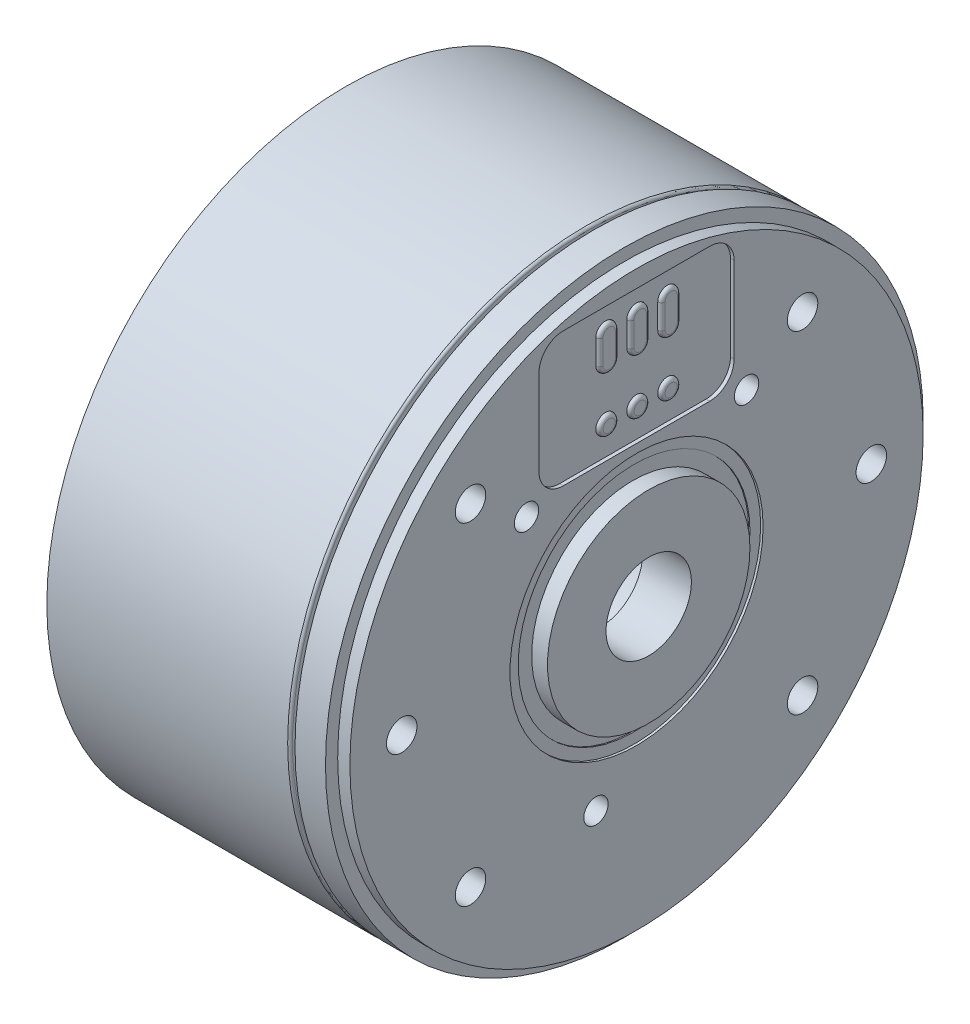
from build123d import *

# Parameters (mm, degrees)
SKETCH_2_R           = 24.5
EXTRUDE_1_DEPTH      = 24
SKETCH_2_17_R        = 24.5
CUT_EXTRUDE_18_DEPTH = 21.5
SKETCH_2_18_R        = 24.5
EXTRUDE_7_DEPTH      = 21.1
SKETCH_2_5_R         = 23.5
EXTRUDE_2_DEPTH      = 25
SKETCH_2_14_R        = 1.5
CUT_EXTRUDE_12_DEPTH = 4
CHAMFER_1_SIZE       = 2
CHAMFER_1_SIZE2      = 1.154700538
SKETCH_2_15_R        = 6.3
SKETCH_2_15_R_2      = 3.5
CUT_EXTRUDE_13_DEPTH = 22
SKETCH_2_16_R        = 3.5
CUT_EXTRUDE_16_DEPTH = 27
SKETCH_3_R           = 8.3
SKETCH_3_R_2         = 3.5
EXTRUDE_6_DEPTH      = 1
SKETCH_3_7_R         = 1.25
SKETCH_3_7_R_2       = 1
CUT_EXTRUDE_17_DEPTH = 4
CUT_EXTRUDE_START    = -0.3
SKETCH_3_8_R         = 9.5
SKETCH_3_8_R_2       = 8.3
CUT_EXTRUDE_19_DEPTH = 0.3
CUT_EXTRUDE_START_2  = -0.2
SKETCH_3_9_R         = 10.377256728
SKETCH_3_9_R_2       = 9.5
CUT_EXTRUDE_20_DEPTH = 0.2
CUT_EXTRUDE_21_DEPTH = 0.3
EXTRUDE_8_DEPTH      = 0.3
EXTRUDE_8_2_DEPTH    = 0.3
EXTRUDE_8_3_DEPTH    = 0.3
FILLET_1_R           = 0.3
FILLET_2_R           = 0.3
FILLET_3_R           = 0.3
SKETCH_3_13_R        = 0.8
EXTRUDE_9_DEPTH      = 0.3
EXTRUDE_9_2_DEPTH    = 0.3
EXTRUDE_9_3_DEPTH    = 0.3
FILLET_4_R           = 0.3
FILLET_5_R           = 0.3
FILLET_6_R           = 0.3
FILLET_7_R           = 0.2


# Some blends are built 0.0001 mm under size
with BuildPart() as part:
    # 草图2 → 凸台-拉伸1 (new body)
    with BuildSketch(Plane(origin=(0, 0, 0), x_dir=(0, 0, -1), z_dir=(1, 0, 0))):
        Circle(SKETCH_2_R)
    extrude(amount=EXTRUDE_1_DEPTH)

    # 草图2<17> → 切除-拉伸18 (cut)
    with BuildSketch(Plane(origin=(0, 0, 0), x_dir=(0, 0, -1), z_dir=(1, 0, 0))):
        Circle(SKETCH_2_17_R)
    extrude(amount=CUT_EXTRUDE_18_DEPTH, mode=Mode.SUBTRACT)



with BuildPart() as body_2:
    # 草图2<18> → 凸台-拉伸7 (new body)
    with BuildSketch(Plane(origin=(0, 0, 0), x_dir=(0, 0, -1), z_dir=(1, 0, 0))):
        Circle(SKETCH_2_18_R)
    extrude(amount=EXTRUDE_7_DEPTH)


with BuildPart() as part_1:
    add(part.part)

    add(body_2.part)  # 凸台-拉伸2 merges body 2
    # 草图2<5> → 凸台-拉伸2 (add)
    with BuildSketch(Plane(origin=(0, 0, 0), x_dir=(0, 0, -1), z_dir=(1, 0, 0))):
        Circle(SKETCH_2_5_R)
    extrude(amount=EXTRUDE_2_DEPTH)

    # 草图2<14> → 切除-拉伸12 (cut)
    with BuildSketch(Plane(origin=(0, 0, 0), x_dir=(0, 0, -1), z_dir=(1, 0, 0))):
        with Locations((0, 9.5)):
            Circle(SKETCH_2_14_R)
        with Locations((9.5, 0)):
            Circle(SKETCH_2_14_R)
        with Locations((0, -9.5)):
            Circle(SKETCH_2_14_R)
        with Locations((-9.5, 0)):
            Circle(SKETCH_2_14_R)
        with Locations((8.838834765, 8.838834765)):
            Circle(SKETCH_2_14_R)
        with Locations((8.838834765, -8.838834765)):
            Circle(SKETCH_2_14_R)
        with Locations((-8.838834765, -8.838834765)):
            Circle(SKETCH_2_14_R)
        with Locations((-8.838834765, 8.838834765)):
            Circle(SKETCH_2_14_R)
    extrude(amount=CUT_EXTRUDE_12_DEPTH, mode=Mode.SUBTRACT)

    # 倒角1
    chamfer_1_edges = [part_1.edges().sort_by_distance(p)[0] for p in [
        (0, 0, 24.5),
    ]]
    chamfer_1_side = [part_1.faces().sort_by_distance(p)[0] for p in [
        (0, 0, 0),
    ]]
    chamfer(chamfer_1_edges, length=CHAMFER_1_SIZE, length2=CHAMFER_1_SIZE2, reference=chamfer_1_side[0])

    # 草图2<15> → 切除-拉伸13 (cut)
    with BuildSketch(Plane(origin=(0, 0, 0), x_dir=(0, 0, -1), z_dir=(1, 0, 0))):
        Circle(SKETCH_2_15_R)
        Circle(SKETCH_2_15_R_2, mode=Mode.SUBTRACT)
    extrude(amount=CUT_EXTRUDE_13_DEPTH, mode=Mode.SUBTRACT)

    # 草图2<16> → 切除-拉伸16 (cut)
    with BuildSketch(Plane(origin=(0, 0, 0), x_dir=(0, 0, -1), z_dir=(1, 0, 0))):
        Circle(SKETCH_2_16_R)
    extrude(amount=CUT_EXTRUDE_16_DEPTH, mode=Mode.SUBTRACT)

    # 草图3 → 凸台-拉伸6 (add)
    with BuildSketch(Plane(origin=(25, 0, 0), x_dir=(0, 0, -1), z_dir=(1, 0, 0))):
        Circle(SKETCH_3_R)
        Circle(SKETCH_3_R_2, mode=Mode.SUBTRACT)
    extrude(amount=EXTRUDE_6_DEPTH)

    # 草图3<7> → 切除-拉伸17 (cut)
    with BuildSketch(Plane(origin=(25, 0, 0), x_dir=(0, 0, -1), z_dir=(1, 0, 0))):
        with Locations((13.611805538, 13.611805538)):
            Circle(SKETCH_3_7_R)
        with Locations((13.611805538, -13.611805538)):
            Circle(SKETCH_3_7_R)
        with Locations((-3.326426064, -13.341566236)):
            Circle(SKETCH_3_7_R_2)
        with Locations((-13.611805538, -13.611805538)):
            Circle(SKETCH_3_7_R)
        with Locations((-13.611805538, 13.611805538)):
            Circle(SKETCH_3_7_R)
        with Locations((-19.25, 0)):
            Circle(SKETCH_3_7_R)
        with Locations((19.25, 0)):
            Circle(SKETCH_3_7_R)
        with Locations((9.020811649, 10.377256728)):
            Circle(SKETCH_3_7_R_2)
        with Locations((-9.020811649, 10.377256728)):
            Circle(SKETCH_3_7_R_2)
    extrude(amount=-CUT_EXTRUDE_17_DEPTH, mode=Mode.SUBTRACT)

    # 草图3<8> → 切除-拉伸19 (cut)
    with BuildSketch(Plane(origin=(25, 0, 0), x_dir=(0, 0, -1), z_dir=(1, 0, 0)).offset(CUT_EXTRUDE_START)):
        Circle(SKETCH_3_8_R)
        Circle(SKETCH_3_8_R_2, mode=Mode.SUBTRACT)
    extrude(amount=CUT_EXTRUDE_19_DEPTH, mode=Mode.SUBTRACT)

    # 草图3<9> → 切除-拉伸20 (cut)
    with BuildSketch(Plane(origin=(25, 0, 0), x_dir=(0, 0, -1), z_dir=(1, 0, 0)).offset(CUT_EXTRUDE_START_2)):
        Circle(SKETCH_3_9_R)
        Circle(SKETCH_3_9_R_2, mode=Mode.SUBTRACT)
    extrude(amount=CUT_EXTRUDE_20_DEPTH, mode=Mode.SUBTRACT)

    # 草图3<10> → 切除-拉伸21 (cut)
    with BuildSketch(Plane(origin=(25, 0, 0), x_dir=(0, 0, -1), z_dir=(1, 0, 0))):
        with BuildLine():
            Line((-6, 11.077256728), (6, 11.077256728))
            ThreePointArc((6, 11.077256728), (7.414213562, 11.663043166), (8, 13.077256728))
            Line((8, 13.077256728), (8, 20.077256728))
            ThreePointArc((8, 20.077256728), (7.414213562, 21.49147029), (6, 22.077256728))
            Line((6, 22.077256728), (-6, 22.077256728))
            ThreePointArc((-6, 22.077256728), (-7.414213562, 21.49147029), (-8, 20.077256728))
            Line((-8, 20.077256728), (-8, 13.077256728))
            ThreePointArc((-8, 13.077256728), (-7.414213562, 11.663043166), (-6, 11.077256728))
        make_face()
    extrude(amount=-CUT_EXTRUDE_21_DEPTH, mode=Mode.SUBTRACT)

    # 圆角7
    fillet_7_edges = [part_1.edges().sort_by_distance(p)[0] for p in [
        (21.1, 0, 24.5),
    ]]
    fillet(fillet_7_edges, radius=FILLET_7_R)


with BuildPart() as body_2_2:
    # 草图3<12> → 凸台-拉伸8 (new body)
    with BuildSketch(Plane(origin=(25, 0, 0), x_dir=(0, 0, -1), z_dir=(1, 0, 0))):
        with BuildLine():
            Line((-3.34, 20.25), (-3.34, 18.25))
            ThreePointArc((-3.34, 18.25), (-2.54, 17.45), (-1.74, 18.25))
            Line((-1.74, 18.25), (-1.74, 20.25))
            ThreePointArc((-1.74, 20.25), (-2.54, 21.05), (-3.34, 20.25))
        make_face()
    extrude(amount=EXTRUDE_8_DEPTH)

    # 圆角1
    fillet_1_edges = [body_2_2.edges().sort_by_distance(p)[0] for p in [
        (25.3, 21.05, 2.54),
        (25.3, 19.25, 3.34),
        (25.3, 17.45, 2.54),
        (25.3, 19.25, 1.74),
    ]]
    fillet(fillet_1_edges, radius=FILLET_1_R - 0.0001)  # a hair under: the kernel refuses the full size


with BuildPart() as body_3:
    # 草图3<12> → Extrude 8 2 (new body)
    with BuildSketch(Plane(origin=(25, 0, 0), x_dir=(0, 0, -1), z_dir=(1, 0, 0))):
        with BuildLine():
            Line((1.74, 20.25), (1.74, 18.25))
            ThreePointArc((1.74, 18.25), (2.54, 17.45), (3.34, 18.25))
            Line((3.34, 18.25), (3.34, 20.25))
            ThreePointArc((3.34, 20.25), (2.54, 21.05), (1.74, 20.25))
        make_face()
    extrude(amount=EXTRUDE_8_2_DEPTH)

    # 圆角3
    fillet_3_edges = [body_3.edges().sort_by_distance(p)[0] for p in [
        (25.3, 21.05, -2.54),
        (25.3, 19.25, -1.74),
        (25.3, 17.45, -2.54),
        (25.3, 19.25, -3.34),
    ]]
    fillet(fillet_3_edges, radius=FILLET_3_R - 0.0001)  # a hair under: the kernel refuses the full size


with BuildPart() as body_4:
    # 草图3<12> → Extrude 8 3 (new body)
    with BuildSketch(Plane(origin=(25, 0, 0), x_dir=(0, 0, -1), z_dir=(1, 0, 0))):
        with BuildLine():
            Line((0.8, 20.25), (0.8, 18.25))
            ThreePointArc((0.8, 18.25), (0, 17.45), (-0.8, 18.25))
            Line((-0.8, 18.25), (-0.8, 20.25))
            ThreePointArc((-0.8, 20.25), (0, 21.05), (0.8, 20.25))
        make_face()
    extrude(amount=EXTRUDE_8_3_DEPTH)

    # 圆角2
    fillet_2_edges = [body_4.edges().sort_by_distance(p)[0] for p in [
        (25.3, 21.05, 0),
        (25.3, 19.25, 0.8),
        (25.3, 17.45, 0),
        (25.3, 19.25, -0.8),
    ]]
    fillet(fillet_2_edges, radius=FILLET_2_R - 0.0001)  # a hair under: the kernel refuses the full size


with BuildPart() as body_5:
    # 草图3<13> → 凸台-拉伸9 (new body)
    with BuildSketch(Plane(origin=(25, 0, 0), x_dir=(0, 0, -1), z_dir=(1, 0, 0))):
        with Locations((2.54, 13.75)):
            Circle(SKETCH_3_13_R)
    extrude(amount=EXTRUDE_9_DEPTH)

    # 圆角6
    # the kernel refuses this fillet: 0.3 mm, written as the material it takes off along each edge
    with BuildSketch(Plane(origin=(25.3, 13.75, -2.54), x_dir=(0, 0, -1), z_dir=(0, -1, 0))) as fillet_6_piece_1:
        with BuildLine():
            CenterArc((0.8 - FILLET_6_R, -FILLET_6_R), FILLET_6_R, 0, 90)
            Line((0.8 - FILLET_6_R, 0), (0.8, 0))
            Line((0.8, 0), (0.8, -FILLET_6_R))
        make_face()
    revolve(axis=Axis((25.3, 13.75, -2.54), (1, 0, 0)), mode=Mode.SUBTRACT)


with BuildPart() as body_6:
    # 草图3<13> → Extrude 9 2 (new body)
    with BuildSketch(Plane(origin=(25, 0, 0), x_dir=(0, 0, -1), z_dir=(1, 0, 0))):
        with Locations((-2.54, 13.75)):
            Circle(SKETCH_3_13_R)
    extrude(amount=EXTRUDE_9_2_DEPTH)

    # 圆角4
    # the kernel refuses this fillet: 0.3 mm, written as the material it takes off along each edge
    with BuildSketch(Plane(origin=(25.3, 13.75, 2.54), x_dir=(0, 0, -1), z_dir=(0, -1, 0))) as fillet_4_piece_1:
        with BuildLine():
            CenterArc((0.8 - FILLET_4_R, -FILLET_4_R), FILLET_4_R, 0, 90)
            Line((0.8 - FILLET_4_R, 0), (0.8, 0))
            Line((0.8, 0), (0.8, -FILLET_4_R))
        make_face()
    revolve(axis=Axis((25.3, 13.75, 2.54), (1, 0, 0)), mode=Mode.SUBTRACT)


with BuildPart() as body_7:
    # 草图3<13> → Extrude 9 3 (new body)
    with BuildSketch(Plane(origin=(25, 0, 0), x_dir=(0, 0, -1), z_dir=(1, 0, 0))):
        with Locations((0, 13.75)):
            Circle(SKETCH_3_13_R)
    extrude(amount=EXTRUDE_9_3_DEPTH)

    # 圆角5
    # the kernel refuses this fillet: 0.3 mm, written as the material it takes off along each edge
    with BuildSketch(Plane(origin=(25.3, 13.75, 0), x_dir=(0, 0, -1), z_dir=(0, -1, 0))) as fillet_5_piece_1:
        with BuildLine():
            CenterArc((0.8 - FILLET_5_R, -FILLET_5_R), FILLET_5_R, 0, 90)
            Line((0.8 - FILLET_5_R, 0), (0.8, 0))
            Line((0.8, 0), (0.8, -FILLET_5_R))
        make_face()
    revolve(axis=Axis((25.3, 13.75, 0), (1, 0, 0)), mode=Mode.SUBTRACT)


solid = Compound([part_1.part, body_2_2.part, body_3.part, body_4.part, body_5.part, body_6.part, body_7.part])
